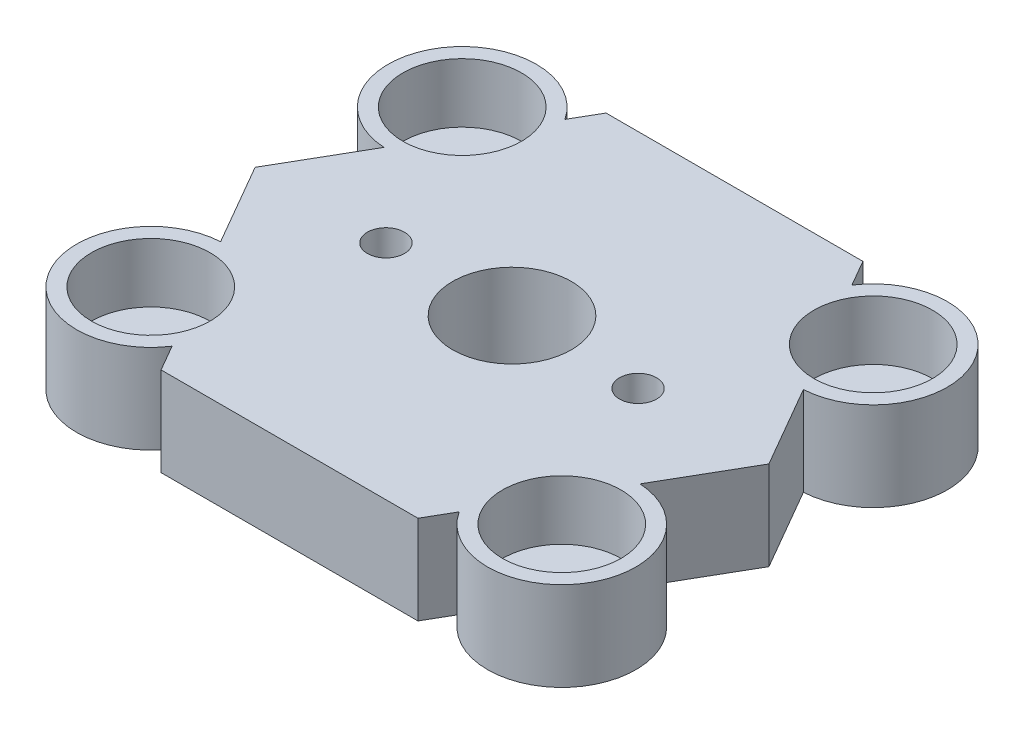
from build123d import *

# Parameters (mm, degrees)
SKETCH2_R           = 5
SKETCH2_R_2         = 1.5
SKETCH2_R_3         = 4
SKETCH2_R_4         = 1.25
BOSS_EXTRUDE1_DEPTH = 6
SKETCH3_R           = 3.5
CUT_EXTRUDE3_DEPTH  = 3
SKETCH4_R           = 4
CUT_EXTRUDE4_DEPTH  = 4


with BuildPart() as part:
    # Sketch2 → Boss-Extrude1 (new body)
    # profile 1 of 5: a face of its own
    with BuildSketch(Plane(origin=(0, 0, 0), x_dir=(1, 0, 0), z_dir=(0, 1, 0))):
        with Locations((-13.856406461, 10.5)):
            Circle(SKETCH2_R)
        with Locations((-13.856406461, 10.5)):
            Circle(SKETCH2_R_2, mode=Mode.SUBTRACT)
    # profile 2 of 5: a face of its own
    with BuildSketch(Plane(origin=(0, 0, 0), x_dir=(1, 0, 0), z_dir=(0, 1, 0))):
        with Locations((13.856406461, 10.5)):
            Circle(SKETCH2_R)
        with Locations((13.856406461, 10.5)):
            Circle(SKETCH2_R_2, mode=Mode.SUBTRACT)
    # profile 3 of 5: a face of its own
    with BuildSketch(Plane(origin=(0, 0, 0), x_dir=(1, 0, 0), z_dir=(0, 1, 0))):
        with Locations((13.856406461, -10.5)):
            Circle(SKETCH2_R)
        with Locations((13.856406461, -10.5)):
            Circle(SKETCH2_R_2, mode=Mode.SUBTRACT)
    # profile 4 of 5: a face of its own
    with BuildSketch(Plane(origin=(0, 0, 0), x_dir=(1, 0, 0), z_dir=(0, 1, 0))):
        with Locations((-13.856406461, -10.5)):
            Circle(SKETCH2_R)
        with Locations((-13.856406461, -10.5)):
            Circle(SKETCH2_R_2, mode=Mode.SUBTRACT)
    # profile 5 of 5: a face of its own
    with BuildSketch(Plane(origin=(0, 0, 0), x_dir=(1, 0, 0), z_dir=(0, 1, 0))):
        Polygon((17.320508076, 0), (8.660254038, 15), (-8.660254038, 15), (-17.320508076, 0), (-8.660254038, -15), (8.660254038, -15), align=None)
        Circle(SKETCH2_R_3, mode=Mode.SUBTRACT)
        with Locations((8.5, 0)):
            Circle(SKETCH2_R_4, mode=Mode.SUBTRACT)
        with Locations((-8.5, 0)):
            Circle(SKETCH2_R_4, mode=Mode.SUBTRACT)
    extrude(amount=BOSS_EXTRUDE1_DEPTH)

    # Sketch3 → Cut-Extrude3 (cut)
    with BuildSketch(Plane.XZ):
        with Locations((-8.5, 0)):
            Circle(SKETCH3_R)
        with Locations((8.5, 0)):
            Circle(SKETCH3_R)
    extrude(amount=-CUT_EXTRUDE3_DEPTH, mode=Mode.SUBTRACT)

    # Sketch4 → Cut-Extrude4 (cut)
    with BuildSketch(Plane(origin=(0, 6, 0), x_dir=(1, 0, 0), z_dir=(0, 1, 0))):
        with Locations((-13.856406461, 10.5)):
            Circle(SKETCH4_R)
        with Locations((13.856406461, 10.5)):
            Circle(SKETCH4_R)
        with Locations((-13.856406461, -10.5)):
            Circle(SKETCH4_R)
        with Locations((13.856406461, -10.5)):
            Circle(SKETCH4_R)
    extrude(amount=-CUT_EXTRUDE4_DEPTH, mode=Mode.SUBTRACT)


solid = part.part
